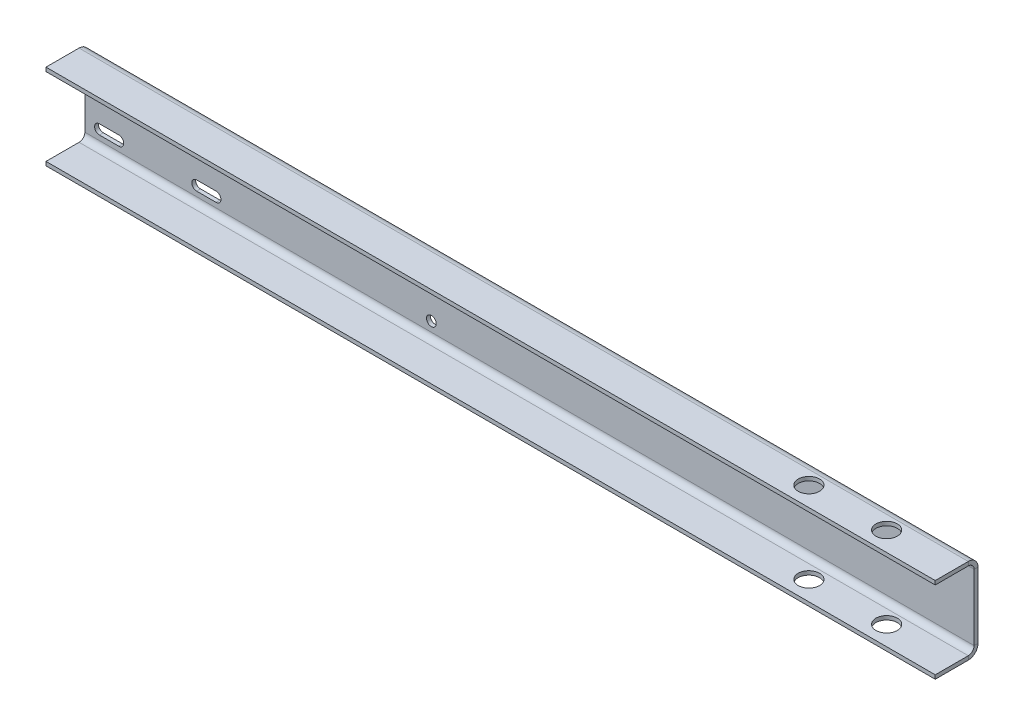
from build123d import *

# Parameters (mm, degrees)
SKETCH1_W                    = 915
SKETCH1_H                    = 88
BASE_FLANGE1_DEPTH           = 4
EDGE_FLANGE1_STRIP_W         = 28
EDGE_FLANGE1_STRIP_H         = 4
EDGE_FLANGE1_STRIP_CUT_DEPTH = 915
EDGE_FLANGE1_DEPTH           = 915
EDGE_FLANGE2_STRIP_W         = 28
EDGE_FLANGE2_STRIP_H         = 4
EDGE_FLANGE2_STRIP_CUT_DEPTH = 915
EDGE_FLANGE2_DEPTH           = 915
CUT_EXTRUDE1_DEPTH           = 871.900176512
CUT_EXTRUDE1_DEPTH_BACK      = 871.900176512
SKETCH12_R                   = 11
CUT_EXTRUDE2_DEPTH           = 872.093059006
SKETCH16_R                   = 5
CUT_EXTRUDE4_DEPTH           = 10


# Sheet-metal steps are written as plain solids
with BuildPart() as part:
    # Sketch1 → Base-Flange1 (new body)
    with BuildSketch(Plane.XY):
        with Locations((-408.018987342, 44)):
            Rectangle(SKETCH1_W, SKETCH1_H)
    extrude(amount=-BASE_FLANGE1_DEPTH)

    # Edge-Flange1 strip (across the edge) → Edge-Flange1 strip cut (cut)
    with BuildSketch(Plane(origin=(49.481012658, 88, 0), x_dir=(0, -1, 0), z_dir=(-1, 0, 0))):
        with Locations((-4, -2)):
            Rectangle(EDGE_FLANGE1_STRIP_W, EDGE_FLANGE1_STRIP_H)
    extrude(amount=EDGE_FLANGE1_STRIP_CUT_DEPTH, mode=Mode.SUBTRACT)

    # Edge-Flange1 section (across the edge) → Edge-Flange1 (add)
    with BuildSketch(Plane(origin=(49.481012658, 88, 0), x_dir=(0, -1, 0), z_dir=(-1, 0, 0))):
        with BuildLine():
            Line((0, 6), (0, 40))
            Line((0, 40), (4, 40))
            Line((4, 40), (4, 6))
            ThreePointArc((4, 6), (5.757359313, 1.757359313), (10, 0))
            Line((10, 0), (10, -4))
            ThreePointArc((10, -4), (2.928932188, -1.071067812), (0, 6))
        make_face()
    extrude(amount=EDGE_FLANGE1_DEPTH)

    # Edge-Flange2 strip (across the edge) → Edge-Flange2 strip cut (cut)
    with BuildSketch(Plane.YZ.offset(-865.518987342)):
        with Locations((-4, -2)):
            Rectangle(EDGE_FLANGE2_STRIP_W, EDGE_FLANGE2_STRIP_H)
    extrude(amount=EDGE_FLANGE2_STRIP_CUT_DEPTH, mode=Mode.SUBTRACT)

    # Edge-Flange2 section (across the edge) → Edge-Flange2 (add)
    with BuildSketch(Plane.YZ.offset(-865.518987342)):
        with BuildLine():
            Line((0, 6), (0, 40))
            Line((0, 40), (4, 40))
            Line((4, 40), (4, 6))
            ThreePointArc((4, 6), (5.757359313, 1.757359313), (10, 0))
            Line((10, 0), (10, -4))
            ThreePointArc((10, -4), (2.928932188, -1.071067812), (0, 6))
        make_face()
    extrude(amount=EDGE_FLANGE2_DEPTH)

    # Sketch12 → Cut-Extrude1 (cut, two sides: drawn at the far end of the back side and taken through both)
    with BuildSketch(Plane.XZ.offset(-CUT_EXTRUDE1_DEPTH_BACK)):
        with Locations(Location((-100.518987342, 20, 0), (0, 0, 270))):
            Circle(SKETCH12_R)
        with Locations(Location((-20.518987342, 20, 0), (0, 0, 270))):
            Circle(SKETCH12_R)
    extrude(amount=CUT_EXTRUDE1_DEPTH + CUT_EXTRUDE1_DEPTH_BACK, mode=Mode.SUBTRACT)

    # Sketch13 → Cut-Extrude2 (cut, through all)
    with BuildSketch(Plane(origin=(0, 0, -4), x_dir=(-1, 0, 0), z_dir=(0, 0, -1))):
        with BuildLine():
            Line((850.518987342, 15), (830.518987342, 15))
            ThreePointArc((830.518987342, 15), (825.518987342, 20), (830.518987342, 25))
            Line((830.518987342, 25), (850.518987342, 25))
            ThreePointArc((850.518987342, 25), (855.518987342, 20), (850.518987342, 15))
        make_face()
        with BuildLine():
            Line((750.518987342, 15), (730.518987342, 15))
            ThreePointArc((730.518987342, 15), (725.518987342, 20), (730.518987342, 25))
            Line((730.518987342, 25), (750.518987342, 25))
            ThreePointArc((750.518987342, 25), (755.518987342, 20), (750.518987342, 15))
        make_face()
    extrude(amount=-CUT_EXTRUDE2_DEPTH, mode=Mode.SUBTRACT)

    # Sketch16 → Cut-Extrude4 (cut)
    with BuildSketch(Plane(origin=(0, 0, -4), x_dir=(-1, 0, 0), z_dir=(0, 0, -1))):
        with Locations((509.018987342, 20)):
            Circle(SKETCH16_R)
    extrude(amount=-CUT_EXTRUDE4_DEPTH, mode=Mode.SUBTRACT)


solid = part.part
